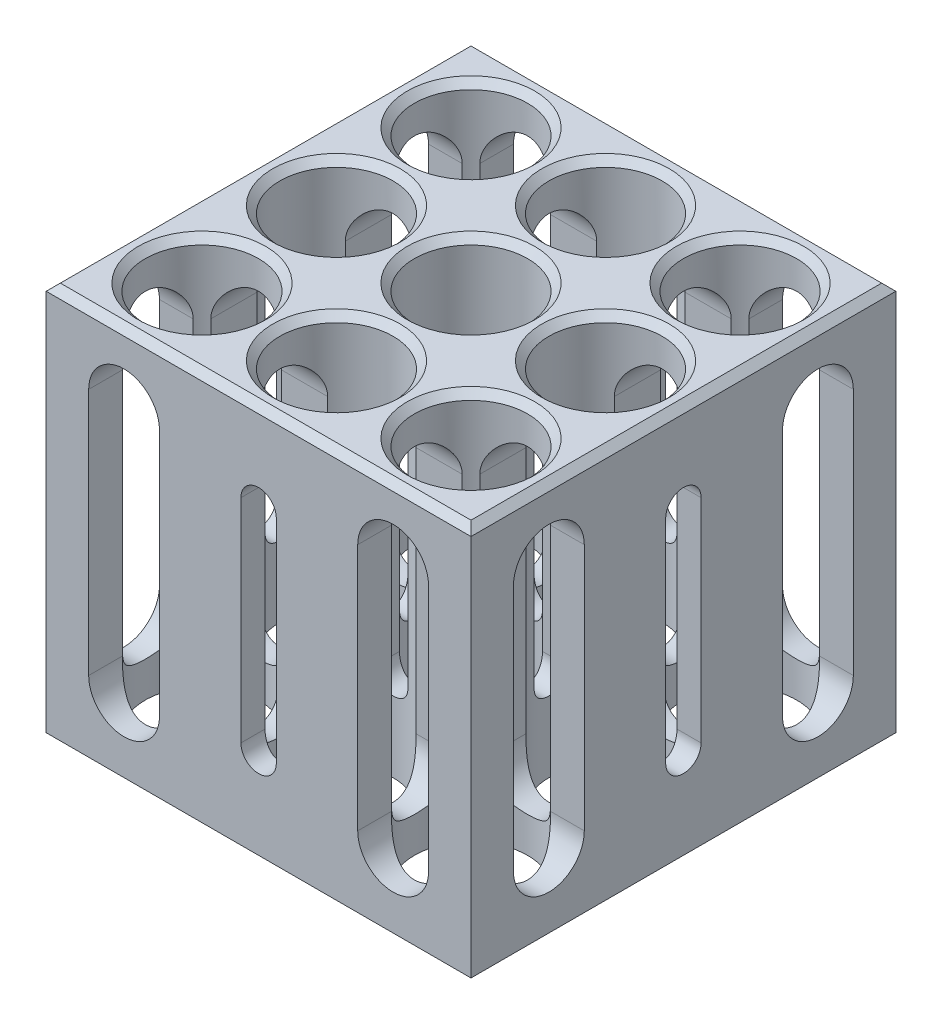
from build123d import *

# Parameters (mm, degrees)
SKETCH1_W               = 76.2
SKETCH1_H               = 76.2
BOSS_EXTRUDE1_DEPTH     = 34.925
SKETCH2_R               = 10.16
CUT_EXTRUDE1_DEPTH      = 89.217019333
FILL_START              = -34.925
FILL_PATTERN1_OUTLINE_R = 10.16
FILL_PATTERN1_DEPTH     = 69.85
CHAMFER1_SIZE           = 1.27
CUT_EXTRUDE2_DEPTH      = 38.1
CUT_EXTRUDE3_DEPTH      = 38.1
MIRROR2_COPY_1_DEPTH    = 38.1


# Read off the part's stored shape, not the designer's step: Fill Pattern1
with BuildPart() as part:
    # Sketch1 → Boss-Extrude1 (new, symmetric)
    with BuildSketch(Plane(origin=(0, 0, 0), x_dir=(1, 0, 0), z_dir=(0, 1, 0))):
        Rectangle(SKETCH1_W, SKETCH1_H)
    extrude(amount=BOSS_EXTRUDE1_DEPTH, both=True)

    # Sketch2 → Cut-Extrude1 (cut, through all)
    with BuildSketch(Plane(origin=(0, 34.925, 0), x_dir=(1, 0, 0), z_dir=(0, 1, 0))):
        with Locations(Location((0, 0, 0), (0, 0, 270))):
            Circle(SKETCH2_R)
    extrude(amount=-CUT_EXTRUDE1_DEPTH, mode=Mode.SUBTRACT)

    # Fill Pattern1 outline → Fill Pattern1 (cut)
    with BuildSketch(Plane(origin=(0, 0, 0), x_dir=(1, 0, 0), z_dir=(0, 1, 0)).offset(FILL_START)):
        with Locations((-24.13, 24.13)):
            Circle(FILL_PATTERN1_OUTLINE_R)
        with Locations((0, 24.13)):
            Circle(FILL_PATTERN1_OUTLINE_R)
        with Locations((24.13, 24.13)):
            Circle(FILL_PATTERN1_OUTLINE_R)
        with Locations((24.13, 0)):
            Circle(FILL_PATTERN1_OUTLINE_R)
        with Locations((24.13, -24.13)):
            Circle(FILL_PATTERN1_OUTLINE_R)
        with Locations((0, -24.13)):
            Circle(FILL_PATTERN1_OUTLINE_R)
        with Locations((-24.13, -24.13)):
            Circle(FILL_PATTERN1_OUTLINE_R)
        with Locations((-24.13, 0)):
            Circle(FILL_PATTERN1_OUTLINE_R)
    extrude(amount=FILL_PATTERN1_DEPTH, mode=Mode.SUBTRACT)

    # Chamfer1
    chamfer1_edges = [part.edges().sort_by_distance(p)[0] for p in [
        (-38.1, 34.925, 0),
        (0, 34.925, 38.1),
        (0, 34.925, -10.16),
        (-34.29, 34.925, -24.13),
        (-10.16, 34.925, -24.13),
        (13.97, 34.925, -24.13),
        (13.97, 34.925, 0),
        (13.97, 34.925, 24.13),
        (-10.16, 34.925, 24.13),
        (38.1, 34.925, 0),
        (-34.29, 34.925, 24.13),
        (-34.29, 34.925, 0),
        (0, 34.925, -38.1),
    ]]
    chamfer(chamfer1_edges, length=CHAMFER1_SIZE)

    # Sketch4 → Cut-Extrude2 (cut, symmetric)
    with BuildSketch(Plane.XY):
        with BuildLine():
            Line((-30.48, -22.225), (-30.48, 22.225))
            ThreePointArc((-30.48, 22.225), (-24.13, 28.575), (-17.78, 22.225))
            Line((-17.78, 22.225), (-17.78, -22.225))
            ThreePointArc((-17.78, -22.225), (-24.13, -28.575), (-30.48, -22.225))
        make_face()
    cut_extrude2 = extrude(amount=CUT_EXTRUDE2_DEPTH, both=True, mode=Mode.SUBTRACT)

    # Sketch6 → Cut-Extrude3 (cut, symmetric)
    with BuildSketch(Plane.XY):
        with BuildLine():
            Line((3.175, 19.05), (3.175, -19.05))
            ThreePointArc((3.175, -19.05), (0, -22.225), (-3.175, -19.05))
            Line((-3.175, -19.05), (-3.175, 19.05))
            ThreePointArc((-3.175, 19.05), (0, 22.225), (3.175, 19.05))
        make_face()
    cut_extrude3 = extrude(amount=CUT_EXTRUDE3_DEPTH, both=True, mode=Mode.SUBTRACT)

    # Mirror1: Cut-Extrude2 across plane
    add(cut_extrude2.mirror(Plane(origin=(0, 0, 0), x_dir=(0, 0, 1), z_dir=(1, 0, 0))), mode=Mode.SUBTRACT)

    # Mirror2: Cut-Extrude2, Cut-Extrude3 across plane
    add(cut_extrude2.mirror(Plane(origin=(0, 0, 0), x_dir=(-0.7071067811865476, 0, 0.7071067811865476), z_dir=(0.7071067811865477, 0, 0.7071067811865475))), mode=Mode.SUBTRACT)
    add(cut_extrude3.mirror(Plane(origin=(0, 0, 0), x_dir=(-0.7071067811865476, 0, 0.7071067811865476), z_dir=(0.7071067811865477, 0, 0.7071067811865475))), mode=Mode.SUBTRACT)

    # Mirror2 copy 1 sketch → Mirror2 copy 1 (cut, symmetric)
    with BuildSketch(Plane.ZY):
        with BuildLine():
            Line((-30.48, -22.225), (-30.48, 22.225))
            ThreePointArc((-30.48, 22.225), (-24.13, 28.575), (-17.78, 22.225))
            Line((-17.78, 22.225), (-17.78, -22.225))
            ThreePointArc((-17.78, -22.225), (-24.13, -28.575), (-30.48, -22.225))
        make_face()
    extrude(amount=MIRROR2_COPY_1_DEPTH, both=True, mode=Mode.SUBTRACT)


solid = part.part
